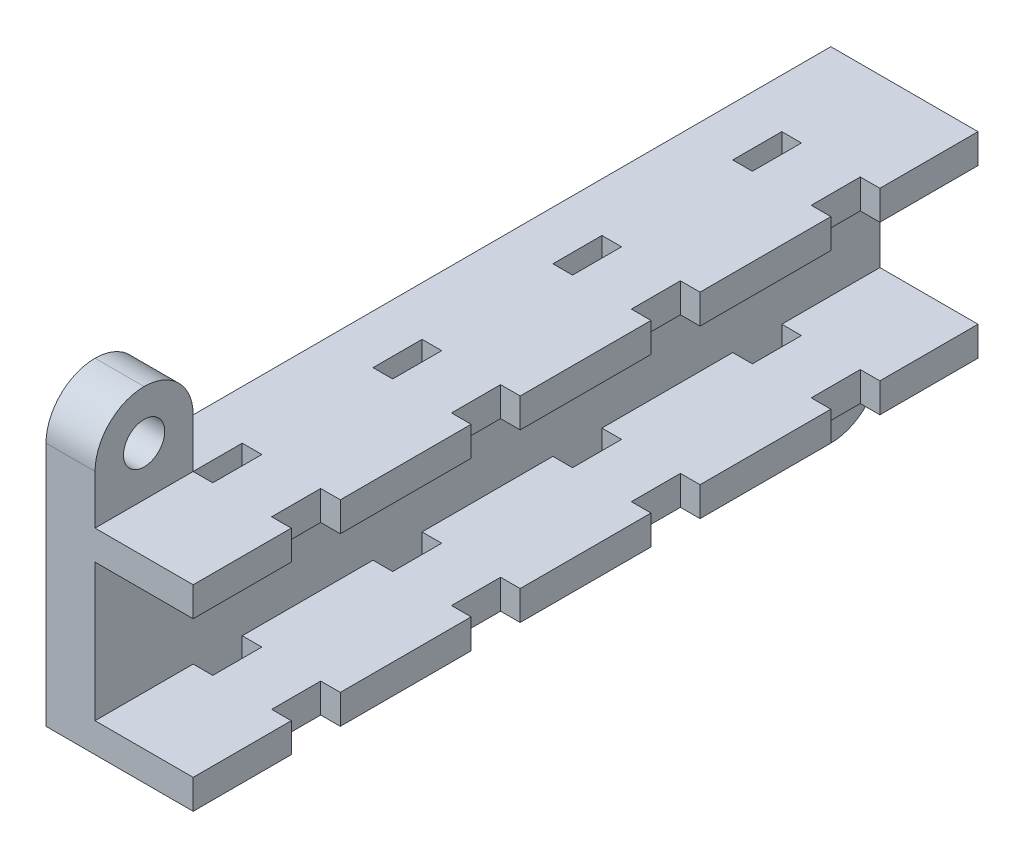
from build123d import *

# Parameters (mm, degrees)
SKETCH1_W           = 80
SKETCH1_H           = 20
SKETCH1_W_2         = 10
SKETCH1_H_2         = 10
SKETCH1_R           = 2.1
BOSS_EXTRUDE1_DEPTH = 5
SKETCH2_W           = 10
SKETCH2_H           = 3
BOSS_EXTRUDE2_DEPTH = 80
FILLET1_R           = 5
SKETCH3_W           = 2
SKETCH3_H           = 5
CUT_EXTRUDE1_DEPTH  = 53.201532545


with BuildPart() as part:
    # Sketch1 → Boss-Extrude1 (new body)
    # profile 1 of 3: a face of its own
    with BuildSketch(Plane(origin=(0, 0, 0), x_dir=(0, 0, -1), z_dir=(1, 0, 0))):
        Rectangle(SKETCH1_W, SKETCH1_H)
    # profile 2 of 3: a face of its own
    with BuildSketch(Plane(origin=(0, 0, 0), x_dir=(0, 0, -1), z_dir=(1, 0, 0))):
        with Locations((-35, 15)):
            Rectangle(SKETCH1_W_2, SKETCH1_H_2)
        with Locations((-35, 15)):
            Circle(SKETCH1_R, mode=Mode.SUBTRACT)
    # profile 3 of 3: a face of its own
    with BuildSketch(Plane(origin=(0, 0, 0), x_dir=(0, 0, -1), z_dir=(1, 0, 0))):
        with Locations((35, -15)):
            Rectangle(SKETCH1_W_2, SKETCH1_H_2)
        with Locations((35, -15)):
            Circle(SKETCH1_R, mode=Mode.SUBTRACT)
    extrude(amount=BOSS_EXTRUDE1_DEPTH)

    # Sketch2 → Boss-Extrude2 (add)
    with BuildSketch(Plane.XY.offset(40)):
        with Locations((10, 8.5)):
            Rectangle(SKETCH2_W, SKETCH2_H)
        with Locations((10, -8.5)):
            Rectangle(SKETCH2_W, SKETCH2_H)
    extrude(amount=-BOSS_EXTRUDE2_DEPTH)

    # Fillet1
    fillet1_edges = [part.edges().sort_by_distance(p)[0] for p in [
        (2.5, 20, 30),
        (2.5, 20, 40),
        (2.5, -20, -40),
        (2.5, -20, -30),
    ]]
    fillet(fillet1_edges, radius=FILLET1_R - 0.0001)  # a hair under: the kernel refuses the full size

    # Sketch3 → Cut-Extrude1 (cut, through all)
    with BuildSketch(Plane.XZ.offset(10)):
        with Locations((6, 27.5)):
            Rectangle(SKETCH3_W, SKETCH3_H)
        with Locations((6, 9.166666667)):
            Rectangle(SKETCH3_W, SKETCH3_H)
        with Locations((6, -9.166666667)):
            Rectangle(SKETCH3_W, SKETCH3_H)
        with Locations((6, -27.5)):
            Rectangle(SKETCH3_W, SKETCH3_H)
        with Locations((14, 27.5)):
            Rectangle(SKETCH3_W, SKETCH3_H)
        with Locations((14, 9.166666667)):
            Rectangle(SKETCH3_W, SKETCH3_H)
        with Locations((14, -9.166666667)):
            Rectangle(SKETCH3_W, SKETCH3_H)
        with Locations((14, -27.5)):
            Rectangle(SKETCH3_W, SKETCH3_H)
    extrude(amount=-CUT_EXTRUDE1_DEPTH, mode=Mode.SUBTRACT)


solid = part.part
